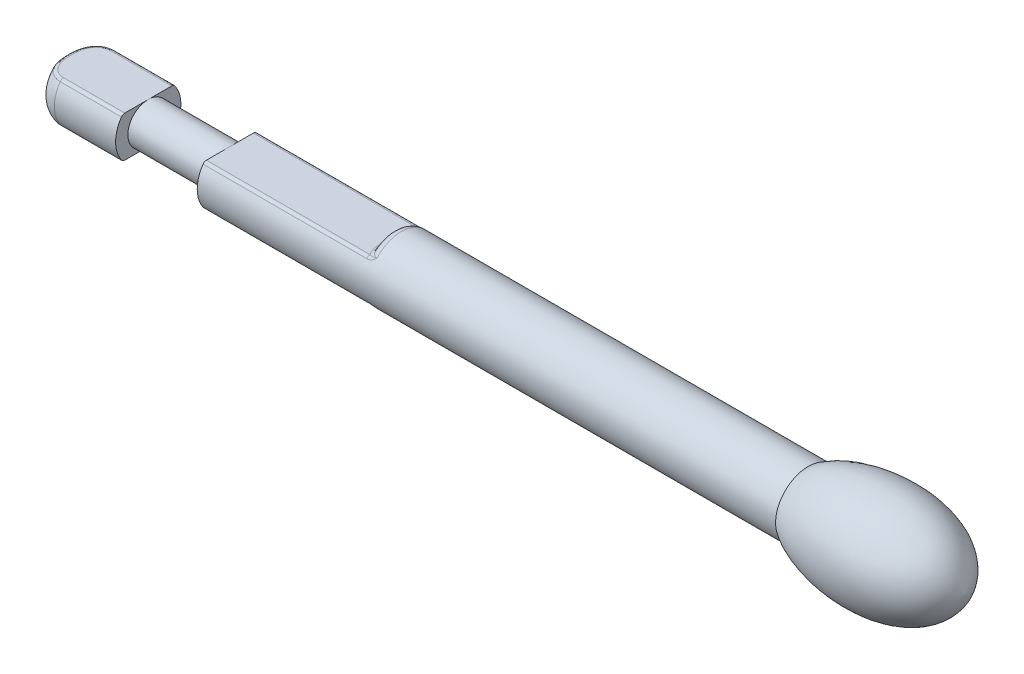
from build123d import *

# Parameters (mm, degrees)
CUT_EXTRUDE5_START = -8
CUT_EXTRUDE5_DEPTH = 8
FILLET1_R          = 0.5
FILLET3_R          = 0.2
FILLET4_R          = 0.1


# Some blends are built 0.0001 mm under size
with BuildPart() as part:
    # Sketch1 → Revolve1 (revolve)
    with BuildSketch(Plane.XY, mode=Mode.PRIVATE) as revolve1_sk:
        with BuildLine():
            Line((0, 0), (0, 0.8))
            Line((0, 0.8), (2, 0.8))
            Line((2, 0.8), (2, 0.5))
            Line((2, 0.5), (4, 0.5))
            Line((4, 0.5), (4, 0.8))
            Line((4, 0.8), (18.166969722, 0.8))
            add(Edge.make_bspline(
                [(18.166969722, 0.8), (19.115973279, 1.43373236), (21.717811379, 1.547874709), (22, 0)],
                knots=[0, 0, 0, 0, 1, 1, 1, 1], degree=3))
            Line((22, 0), (0, 0))
        make_face()
    revolve(revolve1_sk.sketch.rotate(Axis((0, 0, 0), (1, 0, 0)), 90), axis=Axis((0, 0, 0), (1, 0, 0)))

    # Sketch2 → Cut-Extrude5 (cut)
    with BuildSketch(Plane.ZY.offset(CUT_EXTRUDE5_START)):
        with BuildLine():
            Line((0.6244998, 0.5), (-0.6244998, 0.5))
            ThreePointArc((-0.6244998, 0.5), (0, 0.8), (0.6244998, 0.5))
        make_face()
        with BuildLine():
            Line((-0.6244998, -0.5), (0.6244998, -0.5))
            ThreePointArc((0.6244998, -0.5), (0, -0.8), (-0.6244998, -0.5))
        make_face()
    extrude(amount=CUT_EXTRUDE5_DEPTH, mode=Mode.SUBTRACT)

    # Fillet1
    # the kernel refuses this fillet: 0.5 mm, written as the material it takes off along each edge
    with BuildSketch(Plane(origin=(0, 0, 0), x_dir=(0, -0.7854961071297911, 0.6188665976476221), z_dir=(0, 0.6188665976476221, 0.7854961071297911))) as fillet1_piece_1:
        with BuildLine():
            CenterArc((0.8 - FILLET1_R, FILLET1_R), FILLET1_R, 270, 90)
            Line((0.8, FILLET1_R), (0.8, 0))
            Line((0.8, 0), (0.8 - FILLET1_R, 0))
        make_face()
    revolve(axis=Axis((0, 0, 0), (1, 0, 0)), revolution_arc=256.466829176, mode=Mode.SUBTRACT)
    with BuildSketch(Plane(origin=(0, 0, 0), x_dir=(0, -0.7854961071297912, -0.6188665976476219), z_dir=(0, 0.6188665976476219, -0.7854961071297912))) as fillet1_piece_2:
        with BuildLine():
            CenterArc((0.8 - FILLET1_R, -FILLET1_R), FILLET1_R, 0, 90)
            Line((0.8, -FILLET1_R), (0.8, 0))
            Line((0.8, 0), (0.8 - FILLET1_R, 0))
        make_face()
    revolve(axis=Axis((0, 0, 0), (-1, 0, 0)), revolution_arc=256.466829176, mode=Mode.SUBTRACT)

    # Fillet3
    fillet3_edges = [part.edges().sort_by_distance(p)[0] for p in [
        (8, 0.8, 0),
        (8, -0.8, 0),
    ]]
    fillet(fillet3_edges, radius=FILLET3_R)

    # Fillet4
    fillet4_edges = [part.edges().sort_by_distance(p)[0] for p in [
        (8.055234014, -0.5, -0.542805339),
        (8.055234014, -0.5, 0.542805339),
        (8.055234014, 0.5, 0.542805339),
        (8.055234014, 0.5, -0.542805339),
        (8, 0.5, 0),
        (8, -0.5, 0),
    ]]
    fillet(fillet4_edges, radius=FILLET4_R - 0.0001)  # a hair under: the kernel refuses the full size
    fillet4_2_edges = [part.edges().sort_by_distance(p)[0] for p in [
        (1.25, -0.5, 0.6244998),
        (1.25, -0.5, -0.6244998),
        (1.25, 0.5, -0.6244998),
        (1.25, 0.5, 0.6244998),
        (0.041742431, -0.5, -7.62e-07),
        (0.041742431, 0.5, 7.18e-07),
        (6.030893249, -0.5, 0.6244998),
        (6.030893312, -0.5, -0.6244998),
        (6.030893249, 0.5, -0.6244998),
        (6.030893312, 0.5, 0.6244998),
        (0.288291281, 0.5, 0.56299185),
        (0.288291833, 0.5, -0.562992195),
        (0.288291281, -0.5, -0.56299185),
        (0.288291281, -0.5, 0.56299185),
        (8.135138657, 0.509216124, 0.617008056),
        (8.135139476, 0.509216067, -0.617008103),
        (8.135138657, -0.509216124, -0.617008056),
        (8.135139476, -0.509216067, 0.617008103),
    ]]
    fillet(fillet4_2_edges, radius=FILLET4_R)


solid = part.part
